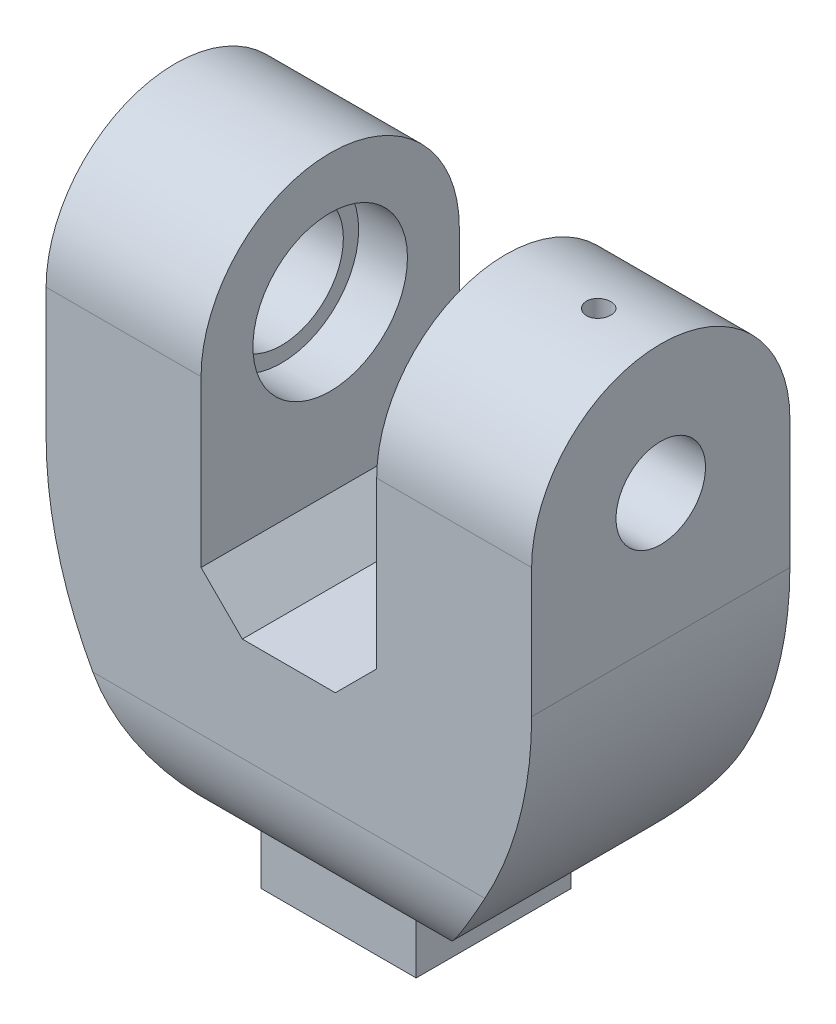
from build123d import *

# Parameters (mm, degrees)
SKETCH1_R               = 15.875
SKETCH1_R_2             = 9.5
BOSS_EXTRUDE1_DEPTH     = 6
BOSS_EXTRUDE2_START     = 13.050000062
SKETCH2_R               = 15.875
SKETCH2_R_2             = 9.5
SKETCH2_R_3             = 7.62
BOSS_EXTRUDE2_DEPTH     = 13.050000062
BOSS_EXTRUDE3_START     = -19.050000062
BOSS_EXTRUDE3_DEPTH     = 19.050000062
BOSS_EXTRUDE4_START     = 21.59
BOSS_EXTRUDE4_DEPTH     = 19.050000062
BOSS_EXTRUDE5_REACH     = 71.404
CUT_EXTRUDE1_START      = -31.75
CUT_EXTRUDE1_DEPTH      = 31.75
SKETCH9_W               = 19.05
SKETCH9_H               = 19.05
BOSS_EXTRUDE8_DEPTH     = 31.75
CHAMFER1_SIZE           = 5.08
SKETCH6_R               = 7.62
SKETCH6_R_2             = 5.25
BOSS_EXTRUDE6_DEPTH     = 13.050000062
SKETCH7_R               = 1.5
CUT_EXTRUDE2_DEPTH      = 12.7
CUT_EXTRUDE3_REACH      = 90.091
CUT_EXTRUDE3_END_RADIUS = 5.25
SKETCH8_R               = 1.5
CUT_EXTRUDE4_REACH      = 86.149
SKETCH10_R              = 5.5
SKETCH10_R_2            = 5.25


# Read off the part's stored shape, not the designer's step: Cut-Extrude1
with BuildPart() as part:
    # Sketch1 → Boss-Extrude1 (new body)
    with BuildSketch(Plane(origin=(0, 0, 0), x_dir=(0, 0, -1), z_dir=(1, 0, 0))):
        Circle(SKETCH1_R)
        Circle(SKETCH1_R_2, mode=Mode.SUBTRACT)
    extrude(amount=BOSS_EXTRUDE1_DEPTH)

    # Sketch2 → Boss-Extrude2 (add)
    # profile 1 of 2: a face of its own
    with BuildSketch(Plane.ZY.offset(BOSS_EXTRUDE2_START)):
        Circle(SKETCH2_R)
        with Locations(Location((0, 0, 0), (0, 0, 180))):
            Circle(SKETCH2_R_2, mode=Mode.SUBTRACT)
    # profile 2 of 2: a face of its own
    with BuildSketch(Plane.ZY.offset(BOSS_EXTRUDE2_START)):
        with Locations(Location((0, 0, 0), (0, 0, 180))):
            Circle(SKETCH2_R_2)
        with Locations(Location((0, 0, 0), (0, 0, 180))):
            Circle(SKETCH2_R_3, mode=Mode.SUBTRACT)
    extrude(amount=-BOSS_EXTRUDE2_DEPTH)


with BuildPart() as body_2:
    # Mirror2: mirrored copy
    add(part.part.mirror(Plane(origin=(16.795, 0, 0), x_dir=(0, 0, 1), z_dir=(1, 0, 0))))

    # Sketch3<3> → Boss-Extrude4 (add)
    with BuildSketch(Plane(origin=(6, 0, 0), x_dir=(0, 0, -1), z_dir=(1, 0, 0)).offset(BOSS_EXTRUDE4_START)):
        with BuildLine():
            ThreePointArc((15.875, 0), (0, -15.875), (-15.875, 0))
            Line((-15.875, 0), (-15.875, -38.1))
            ThreePointArc((-15.875, -38.1), (0, -53.975), (15.875, -38.1))
            Line((15.875, -38.1), (15.875, 0))
        make_face()
    extrude(amount=BOSS_EXTRUDE4_DEPTH)

    # Sketch4 → Boss-Extrude5 (add, up to next)
    with BuildSketch(Plane(origin=(6, 0, 0), x_dir=(0, 0, -1), z_dir=(1, 0, 0)), mode=Mode.PRIVATE) as boss_extrude5_sk1:
        with BuildLine():
            Line((15.875, -25.4), (-15.875, -25.4))
            Line((-15.875, -25.4), (-15.875, -38.1))
            ThreePointArc((-15.875, -38.1), (0, -53.975), (15.875, -38.1))
            Line((15.875, -38.1), (15.875, -25.4))
        make_face()
    boss_extrude5_tool1 = extrude(boss_extrude5_sk1.sketch, amount=BOSS_EXTRUDE5_REACH, mode=Mode.PRIVATE) - body_2.part


with BuildPart() as part_1:
    add(part.part)

    # Sketch3 → Boss-Extrude3 (add)
    with BuildSketch(Plane(origin=(6, 0, 0), x_dir=(0, 0, -1), z_dir=(1, 0, 0)).offset(BOSS_EXTRUDE3_START)):
        with BuildLine():
            ThreePointArc((15.875, 0), (0, -15.875), (-15.875, 0))
            Line((-15.875, 0), (-15.875, -38.1))
            ThreePointArc((-15.875, -38.1), (0, -53.975), (15.875, -38.1))
            Line((15.875, -38.1), (15.875, 0))
        make_face()
    extrude(amount=BOSS_EXTRUDE3_DEPTH)


with BuildPart() as body_2_1:
    add(body_2.part)

    add(part_1.part)  # Boss-Extrude5 merges part
    add(boss_extrude5_tool1.solids().sort_by_distance((6, -38.23351, 0))[0])

    # Cut-Extrude1 outline → Cut-Extrude1 (cut)
    with BuildSketch(Plane.XY.offset(15.875).offset(CUT_EXTRUDE1_START)):
        with BuildLine():
            Line((-13.050000062, -15.875), (-13.050000062, -53.975))
            Line((-13.050000062, -53.975), (7.27, -53.975))
            ThreePointArc((7.27, -53.975), (-7.652500044, -37.465000015), (-13.050000062, -15.875))
        make_face()
        with BuildLine():
            ThreePointArc((46.640000062, -15.875), (41.242500044, -37.465000015), (26.32, -53.975))
            Line((26.32, -53.975), (46.640000062, -53.975))
            Line((46.640000062, -53.975), (46.640000062, -15.875))
        make_face()
    extrude(amount=CUT_EXTRUDE1_DEPTH, mode=Mode.SUBTRACT)

    # Sketch9 → Boss-Extrude8 (add)
    with BuildSketch(Plane(origin=(0, -25.4, 0), x_dir=(1, 0, 0), z_dir=(0, 1, 0))):
        with Locations((16.571454424, 0)):
            Rectangle(SKETCH9_W, SKETCH9_H)
    extrude(amount=-BOSS_EXTRUDE8_DEPTH)

    # Chamfer1
    chamfer1_edges = [body_2_1.edges().sort_by_distance(p)[0] for p in [
        (6, -25.4, 0),
        (27.59, -25.4, 0),
    ]]
    chamfer(chamfer1_edges, length=CHAMFER1_SIZE)

    # Sketch6 → Boss-Extrude6 (add)
    with BuildSketch(Plane(origin=(46.640000062, 0, 0), x_dir=(0, 0, -1), z_dir=(1, 0, 0))):
        Circle(SKETCH6_R)
        Circle(SKETCH6_R_2, mode=Mode.SUBTRACT)
    extrude(amount=-BOSS_EXTRUDE6_DEPTH)

    # Sketch7 → Cut-Extrude2 (cut)
    with BuildSketch(Plane.ZY.offset(13.050000062)):
        with Locations((0, 12.7)):
            Circle(SKETCH7_R)
        with Locations((0, -12.7)):
            Circle(SKETCH7_R)
    extrude(amount=-CUT_EXTRUDE2_DEPTH, mode=Mode.SUBTRACT)

    # Cut-Extrude3: up to this cylinder (the profile starts outside it)
    cut_extrude3_end = Plane(origin=(39.02, 0, 0), z_dir=(1, 0, 0)) * Cylinder(CUT_EXTRUDE3_END_RADIUS, 191.682, mode=Mode.PRIVATE)
    # Sketch8 → Cut-Extrude3 (cut, up to the surface)
    with BuildSketch(Plane(origin=(0, 15.875, 0), x_dir=(1, 0, 0), z_dir=(0, 1, 0)), mode=Mode.PRIVATE) as cut_extrude3_sk1:
        with Locations(Location((39.020000062, 0, 0), (0, 0, 270))):
            Circle(SKETCH8_R)
    cut_extrude3_tool1 = extrude(cut_extrude3_sk1.sketch, amount=-CUT_EXTRUDE3_REACH, mode=Mode.PRIVATE) - cut_extrude3_end
    add(cut_extrude3_tool1.solids().sort_by_distance((39.02, 15.875, 0))[0], mode=Mode.SUBTRACT)

    # Cut-Extrude4: up to this face of the body (flat: up to its plane)
    cut_extrude4_end = Plane(body_2_1.part.faces().sort_by_distance((33.59, 0, 9.231299423))[0])
    # Sketch10 → Cut-Extrude4 (cut, up to the picked face)
    with BuildSketch(Plane(origin=(46.640000062, 0, 0), x_dir=(0, 0, -1), z_dir=(1, 0, 0)), mode=Mode.PRIVATE) as cut_extrude4_sk1:
        Circle(SKETCH10_R)
        Circle(SKETCH10_R_2, mode=Mode.SUBTRACT)
    cut_extrude4_tool1 = split(extrude(cut_extrude4_sk1.sketch, amount=-CUT_EXTRUDE4_REACH, mode=Mode.PRIVATE), bisect_by=cut_extrude4_end, keep=Keep.BOTH, mode=Mode.PRIVATE)
    # Sketch10 → Cut-Extrude4 (cut, up to the picked face)
    with BuildSketch(Plane(origin=(46.640000062, 0, 0), x_dir=(0, 0, -1), z_dir=(1, 0, 0)), mode=Mode.PRIVATE) as cut_extrude4_sk2:
        Circle(SKETCH10_R_2)
    cut_extrude4_tool2 = split(extrude(cut_extrude4_sk2.sketch, amount=-CUT_EXTRUDE4_REACH, mode=Mode.PRIVATE), bisect_by=cut_extrude4_end, keep=Keep.BOTH, mode=Mode.PRIVATE)
    add(cut_extrude4_tool1.solids().sort_by(Axis((46.64, 0, 5.344437), (-1, 0, 0)))[0], mode=Mode.SUBTRACT)
    add(cut_extrude4_tool2.solids().sort_by(Axis((46.64, 0, 0), (-1, 0, 0)))[0], mode=Mode.SUBTRACT)


solid = body_2_1.part
